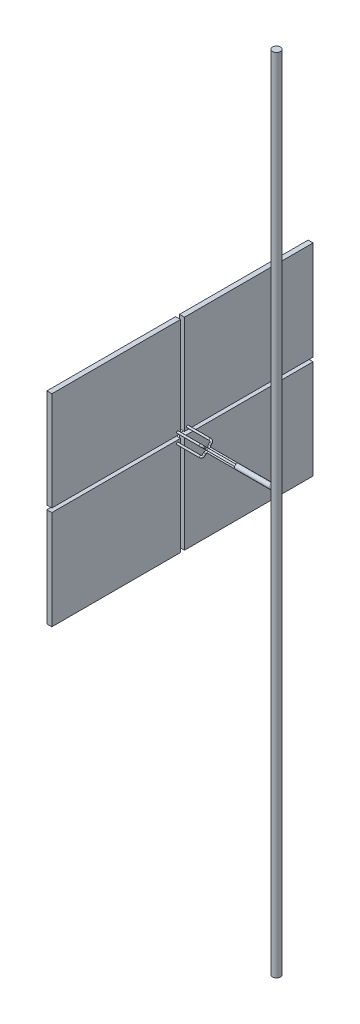
from build123d import *

# Parameters (mm, degrees)
SKETCH_3_W               = 13
SKETCH_3_H               = 10
EXTRUDE_1_DEPTH          = 0.5
EXTRUDE_1_2_DEPTH        = 0.5
EXTRUDE_1_3_DEPTH        = 0.5
EXTRUDE_1_4_DEPTH        = 0.5
SWEEP_4_PROFILE_R        = 0.1
SWEEP_6_PROFILE_R        = 0.25
SWEEP_8_PROFILE_R        = 0.4
MOVE_BODY_3_OUTLINE_R    = 0.1
MOVE_BODY_3_ANGLE        = 90
MOVE_BODY_3_2_OUTLINE_R  = 0.1
MOVE_BODY_3_2_ANGLE      = 90
MOVE_BODY_3_3_OUTLINE_R  = 0.1
MOVE_BODY_3_3_DEPTH      = 2.8000001
MOVE_START               = 0.341421256
MOVE_BODY_3_4_OUTLINE_R  = 0.1
MOVE_BODY_3_4_DEPTH      = 0.165685625
MOVE_START_2             = 3.1999999
MOVE_BODY_3_5_OUTLINE_R  = 0.1
MOVE_BODY_3_5_DEPTH      = 2.8000001
MOVE_BODY_3_6_OUTLINE_R  = 0.1
MOVE_BODY_3_6_ANGLE      = 90
MOVE_BODY_3_7_OUTLINE_R  = 0.1
MOVE_BODY_3_7_ANGLE      = 90
MOVE_BODY_3_8_OUTLINE_R  = 0.1
MOVE_BODY_3_8_DEPTH      = 2.8000001
MOVE_BODY_3_9_OUTLINE_R  = 0.1
MOVE_BODY_3_9_DEPTH      = 0.165685625
MOVE_BODY_3_10_OUTLINE_R = 0.1
MOVE_BODY_3_10_DEPTH     = 2.8000001
MOVE_BODY_3_11_OUTLINE_R = 0.1
MOVE_BODY_3_11_ANGLE     = 90
MOVE_BODY_3_12_OUTLINE_R = 0.1
MOVE_BODY_3_12_ANGLE     = 90
MOVE_BODY_3_13_OUTLINE_R = 0.1
MOVE_BODY_3_13_DEPTH     = 2.8000001
MOVE_START_3             = -0.507106881
MOVE_BODY_3_14_OUTLINE_R = 0.1
MOVE_BODY_3_14_DEPTH     = 0.165685625
MOVE_BODY_3_15_OUTLINE_R = 0.1
MOVE_BODY_3_15_DEPTH     = 2.8000001


with BuildPart() as part:
    # 草图3 → 凸台-拉伸1 (new body)
    with BuildSketch(Plane(origin=(0, 0, 0), x_dir=(0, 0, -1), z_dir=(1, 0, 0))):
        with Locations((6.7, 5.2)):
            Rectangle(SKETCH_3_W, SKETCH_3_H)
    extrude(amount=EXTRUDE_1_DEPTH)


with BuildPart() as body_2:
    # 草图3 → Extrude 1 2 (new body)
    with BuildSketch(Plane(origin=(0, 0, 0), x_dir=(0, 0, -1), z_dir=(1, 0, 0))):
        with Locations((-6.7, -5.2)):
            Rectangle(SKETCH_3_W, SKETCH_3_H)
    extrude(amount=EXTRUDE_1_2_DEPTH)


with BuildPart() as body_3:
    # 草图3 → Extrude 1 3 (new body)
    with BuildSketch(Plane(origin=(0, 0, 0), x_dir=(0, 0, -1), z_dir=(1, 0, 0))):
        with Locations((6.7, -5.2)):
            Rectangle(SKETCH_3_W, SKETCH_3_H)
    extrude(amount=EXTRUDE_1_3_DEPTH)


with BuildPart() as body_4:
    # 草图3 → Extrude 1 4 (new body)
    with BuildSketch(Plane(origin=(0, 0, 0), x_dir=(0, 0, -1), z_dir=(1, 0, 0))):
        with Locations((-6.7, 5.2)):
            Rectangle(SKETCH_3_W, SKETCH_3_H)
    extrude(amount=EXTRUDE_1_4_DEPTH)


with BuildPart() as body_5:
    # 扫描4: sweep along a curve in space
    with BuildLine() as sweep_4_path:
        Line((0, -0.5, 0.5), (2.8, -0.5, 0.5))
        ThreePointArc((2.8, -0.5, 0.5), (2.941421356, -0.458578644, 0.458578644), (3, -0.358578644, 0.358578644))
        Line((3, -0.241421356, 0.241421356), (3, -0.358578644, 0.358578644))
        ThreePointArc((3.2, -0.1, 0.1), (3.058578644, -0.141421356, 0.141421356), (3, -0.241421356, 0.241421356))
        Line((3.2, -0.1, 0.1), (6, -0.1, 0.1))
    # 扫描4 profile (on start of the path) → 扫描4 (sweep)
    with BuildSketch(Plane(origin=(0, -0.5, 0.5), x_dir=(0, 0, 1), z_dir=(1, 0, 0))):
        Circle(SWEEP_4_PROFILE_R)
    sweep(path=sweep_4_path.line)


with BuildPart() as body_6:
    # 扫描6: sweep along a path in 草图31
    with BuildLine(Plane.XY) as sweep_6_path:
        Line((10, 5.5), (10, 0.5))
        ThreePointArc((10, 0.5), (9.85355336, 0.146446579), (9.499999914, 0))
        Line((9.499999914, 0), (6.001497631, 6.02e-07))
    # 扫描6 profile (on start of the path) → 扫描6 (sweep)
    with BuildSketch(Plane(origin=(10, 5.5, 0), x_dir=(0, 0, -1), z_dir=(0, -1, 0))):
        Circle(SWEEP_6_PROFILE_R)
    sweep(path=sweep_6_path.line)


with BuildPart() as body_7:
    # 扫描8: sweep along a path in 草图39
    with BuildLine(Plane.XY) as sweep_8_path:
        Line((10, -42.5), (10, 38.5))
    # 扫描8 profile (on start of the path) → 扫描8 (sweep)
    with BuildSketch(Plane(origin=(10, -42.5, 0), x_dir=(0, 0, 1), z_dir=(0, 1, 0))):
        Circle(SWEEP_8_PROFILE_R)
    sweep(path=sweep_8_path.line)


with BuildPart() as body_8:
    # Move Body 3: read off the stored shape, not the designer's step
    # Move Body 3 outline → Move Body 3 (revolve)
    with BuildSketch(Plane(origin=(2.8, 0.358578644, 0.358578644), x_dir=(0, 0.7071067811865401, 0.7071067811865551), z_dir=(-1, 0, 0))):
        with Locations((0.2, 0)):
            Circle(MOVE_BODY_3_OUTLINE_R)
    revolve(axis=Axis((2.8, 0.358578644, 0.358578644), (0, 0.7071067811865555, -0.7071067811865405)), revolution_arc=MOVE_BODY_3_ANGLE)

    # Move Body 3 2 outline → Move Body 3 2 (revolve)
    with BuildSketch(Plane(origin=(3.2, 0.241421356, 0.241421356), x_dir=(1.3934999695075554e-15, -0.7071067811865401, -0.7071067811865551), z_dir=(1, 0, 0))):
        with Locations((0.2, 0)):
            Circle(MOVE_BODY_3_2_OUTLINE_R)
    revolve(axis=Axis((3.2, 0.241421356, 0.241421356), (0, 0.7071067811865555, -0.7071067811865405)), revolution_arc=MOVE_BODY_3_2_ANGLE)

    # Move Body 3 3 outline → Move Body 3 3 (add)
    with BuildSketch(Plane.YZ):
        with Locations((0.5, 0.5)):
            Circle(MOVE_BODY_3_3_OUTLINE_R)
    extrude(amount=MOVE_BODY_3_3_DEPTH)

    # Move Body 3 4 outline → Move Body 3 4 (add)
    with BuildSketch(Plane(origin=(0, 0, 0), x_dir=(1, 0, 0), z_dir=(0, 0.70710678118654, 0.707106781186555)).offset(MOVE_START)):
        with Locations((3, 0)):
            Circle(MOVE_BODY_3_4_OUTLINE_R)
    extrude(amount=MOVE_BODY_3_4_DEPTH)

    # Move Body 3 5 outline → Move Body 3 5 (add)
    with BuildSketch(Plane.YZ.offset(MOVE_START_2)):
        with Locations((0.1, 0.1)):
            Circle(MOVE_BODY_3_5_OUTLINE_R)
    extrude(amount=MOVE_BODY_3_5_DEPTH)


with BuildPart() as body_9:
    # Move Body 3 6 outline → Move Body 3 6 (revolve)
    with BuildSketch(Plane(origin=(2.8, 0.358578644, -0.358578644), x_dir=(1, 0, 0), z_dir=(0, -0.707106781186552, 0.707106781186543))):
        with Locations((0.2, 0)):
            Circle(MOVE_BODY_3_6_OUTLINE_R)
    revolve(axis=Axis((2.8, 0.358578644, -0.358578644), (0, 0.707106781186543, 0.707106781186552)), revolution_arc=MOVE_BODY_3_6_ANGLE)

    # Move Body 3 7 outline → Move Body 3 7 (revolve)
    with BuildSketch(Plane(origin=(3.2, 0.241421356, -0.241421356), x_dir=(-1, 0, 0), z_dir=(-1.0106430996148604e-15, 0.707106781186552, -0.707106781186543))):
        with Locations((0.2, 0)):
            Circle(MOVE_BODY_3_7_OUTLINE_R)
    revolve(axis=Axis((3.2, 0.241421356, -0.241421356), (0, 0.707106781186543, 0.707106781186552)), revolution_arc=MOVE_BODY_3_7_ANGLE)

    # Move Body 3 8 outline → Move Body 3 8 (add)
    with BuildSketch(Plane.YZ):
        with Locations((0.5, -0.5)):
            Circle(MOVE_BODY_3_8_OUTLINE_R)
    extrude(amount=MOVE_BODY_3_8_DEPTH)

    # Move Body 3 9 outline → Move Body 3 9 (add)
    with BuildSketch(Plane(origin=(0, 0, 0), x_dir=(1, 0, 0), z_dir=(0, 0.707106781186552, -0.707106781186543)).offset(MOVE_START)):
        with Locations((3, 0)):
            Circle(MOVE_BODY_3_9_OUTLINE_R)
    extrude(amount=MOVE_BODY_3_9_DEPTH)

    # Move Body 3 10 outline → Move Body 3 10 (add)
    with BuildSketch(Plane.YZ.offset(MOVE_START_2)):
        with Locations((0.1, -0.1)):
            Circle(MOVE_BODY_3_10_OUTLINE_R)
    extrude(amount=MOVE_BODY_3_10_DEPTH)


with BuildPart() as body_10:
    # Move Body 3 11 outline → Move Body 3 11 (revolve)
    with BuildSketch(Plane(origin=(2.8, -0.358578644, -0.358578644), x_dir=(1, 0, 0), z_dir=(0, 0.707106781186545, 0.70710678118655))):
        with Locations((0.2, 0)):
            Circle(MOVE_BODY_3_11_OUTLINE_R)
    revolve(axis=Axis((2.8, -0.358578644, -0.358578644), (0, 0.70710678118655, -0.707106781186545)), revolution_arc=MOVE_BODY_3_11_ANGLE)

    # Move Body 3 12 outline → Move Body 3 12 (revolve)
    with BuildSketch(Plane(origin=(3.2, -0.241421356, -0.241421356), x_dir=(-1, 0, 0), z_dir=(-1.0106430996148606e-15, -0.707106781186545, -0.70710678118655))):
        with Locations((0.2, 0)):
            Circle(MOVE_BODY_3_12_OUTLINE_R)
    revolve(axis=Axis((3.2, -0.241421356, -0.241421356), (0, 0.70710678118655, -0.707106781186545)), revolution_arc=MOVE_BODY_3_12_ANGLE)

    # Move Body 3 13 outline → Move Body 3 13 (add)
    with BuildSketch(Plane.YZ):
        with Locations((-0.5, -0.5)):
            Circle(MOVE_BODY_3_13_OUTLINE_R)
    extrude(amount=MOVE_BODY_3_13_DEPTH)

    # Move Body 3 14 outline → Move Body 3 14 (add)
    with BuildSketch(Plane(origin=(0, 0, 0), x_dir=(1, 0, 0), z_dir=(0, 0.707106781186545, 0.70710678118655)).offset(MOVE_START_3)):
        with Locations((3, 0)):
            Circle(MOVE_BODY_3_14_OUTLINE_R)
    extrude(amount=MOVE_BODY_3_14_DEPTH)

    # Move Body 3 15 outline → Move Body 3 15 (add)
    with BuildSketch(Plane.YZ.offset(MOVE_START_2)):
        with Locations((-0.1, -0.1)):
            Circle(MOVE_BODY_3_15_OUTLINE_R)
    extrude(amount=MOVE_BODY_3_15_DEPTH)


solid = Compound([part.part, body_2.part, body_3.part, body_4.part, body_5.part, body_6.part, body_7.part, body_8.part, body_9.part, body_10.part])
